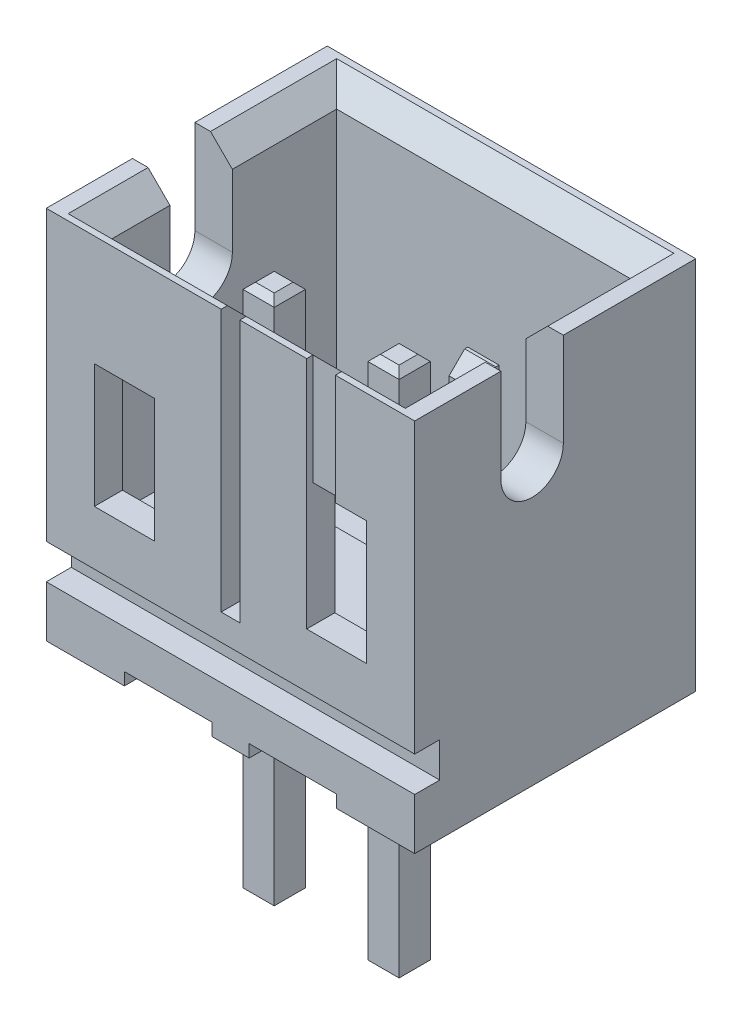
from build123d import *

# Parameters (mm, degrees)
BODY1_W                            = 5.9
BODY1_H                            = 4.5
EXTRUDE_1_DEPTH                    = 6
SKETCH_2_W                         = 4.7
SKETCH_2_H                         = 3.6
CUT_EXTRUDE_1_DEPTH                = 4.2
SKETCH_3_W                         = 5.9
SKETCH_3_H                         = 0.56
CUT_EXTRUDE_2_DEPTH                = 0.4
CHAMFER_1_SIZE                     = 0.35
CUT_EXTRUDE_3_REACH                = 11.543
SKETCH_4_W                         = 0.96
SKETCH_4_H                         = 1.98
SKETCH_5_W                         = 1.4
SKETCH_5_H                         = 0.2
CUT_EXTRUDE_4_DEPTH                = 10.54253635
SKETCH_7_W                         = 0.46
SKETCH_7_H                         = 1.77
CUT_EXTRUDE_5_DEPTH                = 0.1
CUT_EXTRUDE_6_REACH                = 11.543
SKETCH_8_W                         = 0.3
SKETCH_8_H                         = 4.2
CUT_EXTRUDE_7_REACH                = 11.543
SKETCH_15_W                        = 4.7
SKETCH_15_H                        = 1.95
CUT_EXTRUDE_9_DEPTH                = 0.65
CHAMFER_7_SIZE                     = 0.65
SKETCH_10_W                        = 0.5
SKETCH_10_H                        = 2.25
EXTRUDE_2_DEPTH                    = 0.3
CHAMFER_2_SIZE                     = 0.25
EXTRUDE_START                      = -4.9
SKETCH_12_W                        = 0.5
SKETCH_12_H                        = 0.5
EXTRUDE_4_DEPTH                    = 8.5
CHAMFER_3_SIZE                     = 0.1
CHAMFER_4_SIZE                     = 0.1
PATTERN_LINEAR_2_COUNT             = 2
PATTERN_LINEAR_2_PITCH             = 2
CHAMFER_3_OF_PATTERN_LINEAR_2_SIZE = 0.1
CHAMFER_4_OF_PATTERN_LINEAR_2_SIZE = 0.1
SKETCH_16_R                        = 0.05
CUT_EXTRUDE_10_DEPTH               = 3.4


with BuildPart() as part:
    # Body1 → Бобышка-Вытянуть1 (new body)
    with BuildSketch(Plane(origin=(0, 0, 0), x_dir=(1, 0, 0), z_dir=(0, 1, 0))):
        with Locations((2.95, -2.25)):
            Rectangle(BODY1_W, BODY1_H)
    extrude(amount=EXTRUDE_1_DEPTH)

    # Эскиз2 → Вырез-Вытянуть1 (cut)
    with BuildSketch(Plane(origin=(0, 6, 0), x_dir=(1, 0, 0), z_dir=(0, 1, 0))):
        with Locations((2.95, -2.25)):
            Rectangle(SKETCH_2_W, SKETCH_2_H)
    extrude(amount=-CUT_EXTRUDE_1_DEPTH, mode=Mode.SUBTRACT)

    # Эскиз3 → Вырез-Вытянуть2 (cut)
    with BuildSketch(Plane.XY.offset(4.5)):
        with Locations((2.95, 1.1)):
            Rectangle(SKETCH_3_W, SKETCH_3_H)
    extrude(amount=-CUT_EXTRUDE_2_DEPTH, mode=Mode.SUBTRACT)

    # Фаска1
    chamfer_1_edges = [part.edges().sort_by_distance(p)[0] for p in [
        (2.95, 6, 4.05),
        (5.3, 6, 2.25),
        (2.95, 6, 0.45),
        (0.6, 6, 2.25),
    ]]
    chamfer(chamfer_1_edges, length=CHAMFER_1_SIZE)

    # Эскиз4 → Вырез-Вытянуть3 (cut, up to next)
    with BuildSketch(Plane.XY.offset(4.5), mode=Mode.PRIVATE) as cut_extrude_3_sk1:
        with Locations((1.25, 3.24)):
            Rectangle(SKETCH_4_W, SKETCH_4_H)
    cut_extrude_3_tool1 = extrude(cut_extrude_3_sk1.sketch, amount=-CUT_EXTRUDE_3_REACH, mode=Mode.PRIVATE) & part.part
    # Эскиз4 → Вырез-Вытянуть3 (cut, up to next)
    with BuildSketch(Plane.XY.offset(4.5), mode=Mode.PRIVATE) as cut_extrude_3_sk2:
        with Locations((4.65, 3.24)):
            Rectangle(SKETCH_4_W, SKETCH_4_H)
    cut_extrude_3_tool2 = extrude(cut_extrude_3_sk2.sketch, amount=-CUT_EXTRUDE_3_REACH, mode=Mode.PRIVATE) & part.part
    add(cut_extrude_3_tool1.solids().sort_by_distance((1.25, 3.24, 4.5))[0], mode=Mode.SUBTRACT)
    add(cut_extrude_3_tool2.solids().sort_by_distance((4.65, 3.24, 4.5))[0], mode=Mode.SUBTRACT)

    # Эскиз5 → Вырез-Вытянуть4 (cut, through all)
    with BuildSketch(Plane.XY.offset(4.5)):
        with Locations((1.95, 0.1)):
            Rectangle(SKETCH_5_W, SKETCH_5_H)
    cut_extrude_4 = extrude(amount=-CUT_EXTRUDE_4_DEPTH, mode=Mode.SUBTRACT)

    # Эскиз7 → Вырез-Вытянуть5 (cut)
    with BuildSketch(Plane.XY.offset(4.5)):
        with Locations((4.4, 5.115)):
            Rectangle(SKETCH_7_W, SKETCH_7_H)
    extrude(amount=-CUT_EXTRUDE_5_DEPTH, mode=Mode.SUBTRACT)

    # Эскиз8 → Вырез-Вытянуть6 (cut, up to next)
    with BuildSketch(Plane.XY.offset(4.5), mode=Mode.PRIVATE) as cut_extrude_6_sk1:
        with Locations((2.95, 3.9)):
            Rectangle(SKETCH_8_W, SKETCH_8_H)
    cut_extrude_6_tool1 = extrude(cut_extrude_6_sk1.sketch, amount=-CUT_EXTRUDE_6_REACH, mode=Mode.PRIVATE) & part.part
    add(cut_extrude_6_tool1.solids().sort_by_distance((2.95, 3.9, 4.5))[0], mode=Mode.SUBTRACT)

    # Эскиз9 → Вырез-Вытянуть7 (cut, up to next)
    with BuildSketch(Plane.ZY, mode=Mode.PRIVATE) as cut_extrude_7_sk1:
        with BuildLine():
            Line((2.12, 6), (3.12, 6))
            Line((3.12, 6), (3.12, 4.5))
            ThreePointArc((3.12, 4.5), (2.62, 4), (2.12, 4.5))
            Line((2.12, 4.5), (2.12, 6))
        make_face()
    cut_extrude_7_tool1 = extrude(cut_extrude_7_sk1.sketch, amount=-CUT_EXTRUDE_7_REACH, mode=Mode.PRIVATE) & part.part
    cut_extrude_7 = cut_extrude_7_tool1.solids().sort_by_distance((0, 5.05036, 2.62))[0]
    add(cut_extrude_7, mode=Mode.SUBTRACT)

    # Зеркальное отражение1: Вырез-Вытянуть7 across plane
    add(cut_extrude_7.mirror(Plane(origin=(2.95, 0, 0), x_dir=(0, 0, 1), z_dir=(1, 0, 0))), mode=Mode.SUBTRACT)

    # Эскиз15 → Вырез-Вытянуть9 (cut)
    with BuildSketch(Plane(origin=(0, 1.8, 0), x_dir=(1, 0, 0), z_dir=(0, 1, 0))):
        with Locations((2.95, -1.425)):
            Rectangle(SKETCH_15_W, SKETCH_15_H)
    extrude(amount=-CUT_EXTRUDE_9_DEPTH, mode=Mode.SUBTRACT)

    # Фаска7
    chamfer_7_edges = [part.edges().sort_by_distance(p)[0] for p in [
        (2.95, 1.15, 2.4),
    ]]
    chamfer(chamfer_7_edges, length=CHAMFER_7_SIZE - 0.0001)  # a hair under: the kernel refuses the full size

    # Эскиз10 → Бобышка-Вытянуть2 (add)
    with BuildSketch(Plane.XY.offset(0.45)):
        with Locations((2.95, 2.275)):
            Rectangle(SKETCH_10_W, SKETCH_10_H)
    extrude(amount=EXTRUDE_2_DEPTH)

    # Фаска2
    chamfer_2_edges = [part.edges().sort_by_distance(p)[0] for p in [
        (2.95, 3.4, 0.75),
    ]]
    chamfer(chamfer_2_edges, length=CHAMFER_2_SIZE)

    # Эскиз12 → Бобышка-Вытянуть4 (add)
    with BuildSketch(Plane.XZ.offset(-0.2).offset(EXTRUDE_START)):
        with Locations((1.95, 2.8)):
            Rectangle(SKETCH_12_W, SKETCH_12_H)
    extrude_4 = extrude(amount=EXTRUDE_4_DEPTH)

    # Фаска3
    chamfer_3_edges = [part.edges().sort_by_distance(p)[0] for p in [
        (1.7, -3.4, 2.8),
        (1.95, -3.4, 2.55),
        (2.2, -3.4, 2.8),
        (1.95, -3.4, 3.05),
    ]]
    chamfer(chamfer_3_edges, length=CHAMFER_3_SIZE)

    # Фаска4
    chamfer_4_edges = [part.edges().sort_by_distance(p)[0] for p in [
        (1.7, 5.1, 2.8),
        (1.95, 5.1, 2.55),
        (2.2, 5.1, 2.8),
        (1.95, 5.1, 3.05),
    ]]
    chamfer(chamfer_4_edges, length=CHAMFER_4_SIZE)

    # Линейный массив2: Вырез-Вытянуть4, Бобышка-Вытянуть4 ×2
    with Locations(*[(i * PATTERN_LINEAR_2_PITCH, 0, 0) for i in range(1, PATTERN_LINEAR_2_COUNT)]):
        add(cut_extrude_4, mode=Mode.SUBTRACT)
        add(extrude_4)

    # Фаска3 of Линейный массив2
    chamfer_3_of_pattern_linear_2_edges = [part.edges().sort_by_distance(p)[0] for p in [
        (3.7, -3.4, 2.8),
        (3.95, -3.4, 2.55),
        (4.2, -3.4, 2.8),
        (3.95, -3.4, 3.05),
    ]]
    chamfer(chamfer_3_of_pattern_linear_2_edges, length=CHAMFER_3_OF_PATTERN_LINEAR_2_SIZE)

    # Фаска4 of Линейный массив2
    chamfer_4_of_pattern_linear_2_edges = [part.edges().sort_by_distance(p)[0] for p in [
        (3.7, 5.1, 2.8),
        (3.95, 5.1, 2.55),
        (4.2, 5.1, 2.8),
        (3.95, 5.1, 3.05),
    ]]
    chamfer(chamfer_4_of_pattern_linear_2_edges, length=CHAMFER_4_OF_PATTERN_LINEAR_2_SIZE)

    # Эскиз16 → Вырез-Вытянуть10 (cut)
    with BuildSketch(Plane.XZ):
        with Locations((1.95, 2.8)):
            Circle(SKETCH_16_R)
    extrude(amount=CUT_EXTRUDE_10_DEPTH, mode=Mode.SUBTRACT)


solid = part.part
